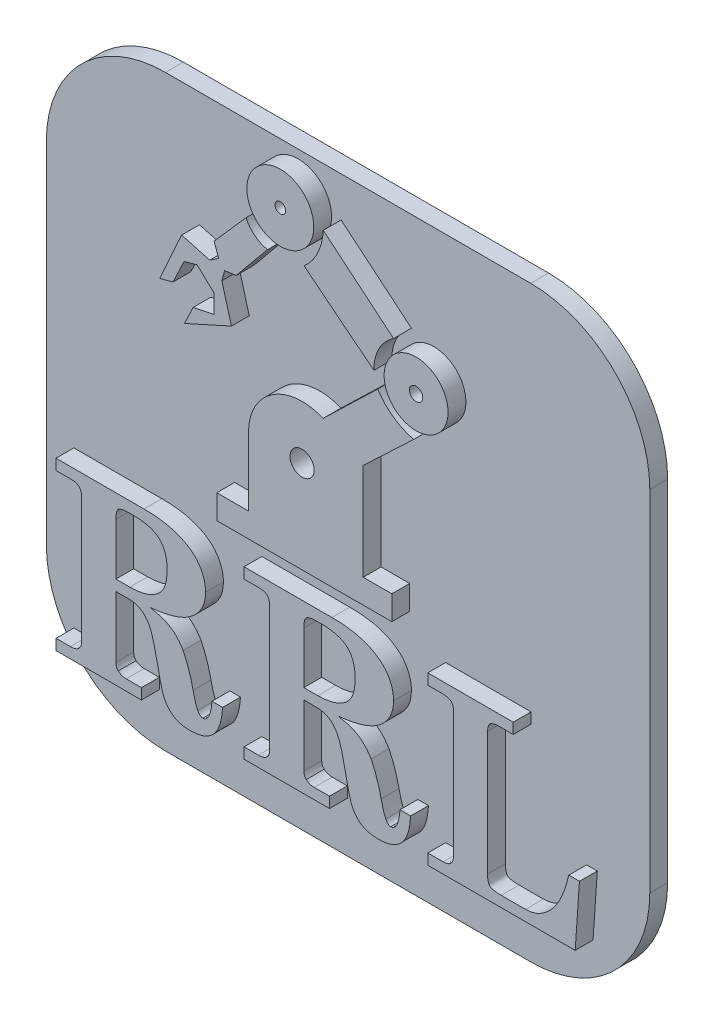
from build123d import *

# Parameters (mm, degrees)
SKETCH1_R             = 1.016959075
BOSS_EXTRUDE1_DEPTH   = 1.5
BOSS_EXTRUDE1_2_DEPTH = 1.5
BOSS_EXTRUDE1_3_DEPTH = 1.5
SKETCH1_R_2           = 2.685408693
SKETCH1_R_3           = 0.561589098
BOSS_EXTRUDE1_4_DEPTH = 1.5
SKETCH1_R_4           = 2.807006912
SKETCH1_R_5           = 0.450271141
BOSS_EXTRUDE1_5_DEPTH = 1.5
BOSS_EXTRUDE2_DEPTH   = 1.5
BOSS_EXTRUDE2_2_DEPTH = 1.5
BOSS_EXTRUDE2_3_DEPTH = 1.5
BOSS_EXTRUDE4_DEPTH   = 1.5


with BuildPart() as part:
    # Sketch1 → Boss-Extrude1 (new body)
    with BuildSketch(Plane.XY):
        with BuildLine():
            Line((15.817518323, 22.448037767), (15.817518323, 20.418411873))
            Line((15.817518323, 20.418411873), (30.520730332, 20.418411873))
            Line((30.520730332, 20.418411873), (30.520730332, 22.448037767))
            Line((30.520730332, 22.448037767), (28.118803331, 22.448037767))
            Line((28.118803331, 22.448037767), (28.118803331, 30.586880413))
            Line((28.118803331, 30.586880413), (32.356715468, 34.59428744))
            ThreePointArc((32.356715468, 34.59428744), (30.63896661, 35.379763507), (29.338154461, 36.74926033))
            Line((29.338154461, 36.74926033), (24.745314888, 32.318215988))
            ThreePointArc((24.745314888, 32.318215988), (20.540196696, 31.958270733), (18.483900556, 28.272592265))
            Line((18.483900556, 28.272592265), (18.483900556, 22.448037767))
            Line((18.483900556, 22.448037767), (15.817518323, 22.448037767))
        make_face()
        with Locations((22.98159331, 28.179719688)):
            Circle(SKETCH1_R, mode=Mode.SUBTRACT)
    extrude(amount=BOSS_EXTRUDE1_DEPTH)



with BuildPart() as body_2:
    # Sketch1 → Boss-Extrude1 2 (new body)
    with BuildSketch(Plane.XY):
        with BuildLine():
            ThreePointArc((29.015655488, 37.94504893), (29.434631401, 39.731831286), (30.665977695, 41.092683339))
            Line((30.665977695, 41.092683339), (24.760616604, 46.013803391))
            ThreePointArc((24.760616604, 46.013803391), (24.30211407, 44.150054799), (23.149625269, 42.615273725))
            Line((23.149625269, 42.615273725), (29.015655488, 37.94504893))
        make_face()
    extrude(amount=BOSS_EXTRUDE1_2_DEPTH)


with BuildPart() as body_3:
    # Sketch1 → Boss-Extrude1 3 (new body)
    with BuildSketch(Plane.XY):
        with BuildLine():
            Line((17.449253701, 39.072412667), (20.074038001, 42.260506839))
            ThreePointArc((20.074038001, 42.260506839), (19.002575479, 42.756115786), (18.276240535, 43.686759495))
            Line((18.276240535, 43.686759495), (15.591529653, 40.642489121))
            Line((15.591529653, 40.642489121), (15.976540764, 39.573653066))
            Line((15.976540764, 39.573653066), (15.224752356, 39.072412667))
            Line((15.224752356, 39.072412667), (12.860949168, 39.713785325))
            Line((12.860949168, 39.713785325), (11.025557634, 35.640511645))
            Line((11.025557634, 35.640511645), (12.148988398, 35.951717417))
            Line((12.148988398, 35.951717417), (13.064422422, 37.897977453))
            Line((13.064422422, 37.897977453), (14.160422863, 38.201584647))
            Line((14.160422863, 38.201584647), (15.591529653, 36.868222472))
            Line((15.591529653, 36.868222472), (15.591529653, 35.304552284))
            Line((15.591529653, 35.304552284), (13.826060104, 34.93121306))
            Line((13.826060104, 34.93121306), (13.110313527, 33.409498853))
            Line((13.110313527, 33.409498853), (17.044646261, 35.185280439))
            Line((17.044646261, 35.185280439), (16.243147445, 38.079509591))
            Line((16.243147445, 38.079509591), (16.476430298, 38.939282368))
            Line((16.476430298, 38.939282368), (17.449253701, 39.072412667))
        make_face()
    extrude(amount=BOSS_EXTRUDE1_3_DEPTH)


with BuildPart() as body_4:
    # Sketch1 → Boss-Extrude1 4 (new body)
    with BuildSketch(Plane.XY):
        with Locations((32.558105055, 38.010940607)):
            Circle(SKETCH1_R_2)
        with Locations((32.558105055, 38.010940607)):
            Circle(SKETCH1_R_3, mode=Mode.SUBTRACT)
    extrude(amount=BOSS_EXTRUDE1_4_DEPTH)


with BuildPart() as body_5:
    # Sketch1 → Boss-Extrude1 5 (new body)
    with BuildSketch(Plane.XY):
        with Locations((21.155122038, 45.850167403)):
            Circle(SKETCH1_R_4)
        with Locations((21.155122038, 45.850167403)):
            Circle(SKETCH1_R_5, mode=Mode.SUBTRACT)
    extrude(amount=BOSS_EXTRUDE1_5_DEPTH)


with BuildPart() as body_6:
    # Sketch2 → Boss-Extrude2 (new body)
    with BuildSketch(Plane.XY):
        with BuildLine():
            Line((2.308836419, 18.20675943), (9.69585565, 18.20675943))
            add(Edge.make_bspline(
                [(9.69585565, 18.20675943), (9.842636549, 18.204682502), (10.128847257, 18.200632664), (10.548133108, 18.182533074), (10.94659102, 18.145332644), (11.324752005, 18.095786159), (11.681333758, 18.031284482), (12.017159879, 17.953977552), (12.330785454, 17.857062954), (12.626781033, 17.752121093), (12.900887854, 17.630268745), (13.158123223, 17.501487815), (13.397155113, 17.361096027), (13.618092571, 17.210007203), (13.821853124, 17.050261025), (14.00491632, 16.8777471), (14.171221258, 16.695118132), (14.366856815, 16.439663243), (14.5703299, 16.101624942), (14.747290407, 15.668881299), (14.854641212, 15.213060341), (14.866800472, 14.900839913), (14.872938983, 14.743217763)],
                knots=[0, 0, 0, 0, 1.260796864, 2.458450407, 3.603348749, 4.696868034, 5.733149247, 6.714703153, 7.654483761, 8.551049231, 9.410311666, 10.229003047, 11.020794849, 11.789116025, 12.526438116, 13.242153704, 13.946977727, 14.645554491, 16.003253973, 17.321296627, 18.647676625, 20, 20, 20, 20], degree=3))
            add(Edge.make_bspline(
                [(14.872938983, 14.743217763), (14.868551909, 14.617667346), (14.859914649, 14.370484021), (14.793718868, 14.008399689), (14.685443408, 13.66430055), (14.527595091, 13.341300966), (14.329815152, 13.035421221), (14.086436668, 12.74847169), (13.799061115, 12.480364414), (13.581926529, 12.324343985), (13.470695393, 12.244419686)],
                knots=[0, 0, 0, 0, 1.006615866, 1.981822625, 2.942272039, 3.891414032, 4.85650664, 5.856958922, 6.902188287, 8, 8, 8, 8], degree=3))
            add(Edge.make_bspline(
                [(13.470695393, 12.244419686), (13.377304484, 12.184686972), (13.182768844, 12.060262209), (12.859920038, 11.902889802), (12.500805089, 11.763303077), (12.107237722, 11.637670389), (11.678559987, 11.525905601), (11.213283148, 11.430879565), (10.71254915, 11.352629417), (10.365379081, 11.315578457), (10.186640906, 11.296503019)],
                knots=[0, 0, 0, 0, 0.770522959, 1.605018928, 2.492419048, 3.448517842, 4.476706657, 5.572020456, 6.749971061, 8, 8, 8, 8], degree=3))
            add(Edge.make_bspline(
                [(10.186640906, 11.296503019), (10.363882657, 11.264622678), (10.69965425, 11.204227693), (11.167368754, 11.077205412), (11.569913564, 10.920203556), (11.917788716, 10.735510771), (12.221078797, 10.507523862), (12.499704238, 10.239203414), (12.759553779, 9.922261839), (12.910374779, 9.685628931), (12.988323598, 9.563329943)],
                knots=[0, 0, 0, 0, 1.260855103, 2.388598191, 3.387941535, 4.281421676, 5.137767289, 6.036055688, 6.984974634, 8, 8, 8, 8], degree=3))
            add(Edge.make_bspline(
                [(12.988323598, 9.563329943), (13.073342443, 9.383138423), (13.248654333, 9.011577079), (13.465655378, 8.413397265), (13.66774967, 7.76752895), (13.774558568, 7.314903941), (13.829669752, 7.081358789)],
                knots=[0, 0, 0, 0, 0.909803941, 1.87604819, 2.904084753, 4, 4, 4, 4], degree=3))
            add(Edge.make_bspline(
                [(13.829669752, 7.081358789), (13.86238334, 6.939034232), (13.922685743, 6.676681081), (14.018288072, 6.321009191), (14.114432513, 6.037573465), (14.187589256, 5.877800027), (14.21949347, 5.808121609)],
                knots=[0, 0, 0, 0, 1.313125144, 2.420541671, 3.311186147, 4, 4, 4, 4], degree=3))
            add(Edge.make_bspline(
                [(14.21949347, 5.808121609), (14.24903681, 5.755956284), (14.303135186, 5.660433593), (14.40890838, 5.551986737), (14.519764302, 5.47725996), (14.60086211, 5.467769354), (14.640166547, 5.463169686)],
                knots=[0, 0, 0, 0, 1.257126063, 2.301990172, 3.177051494, 4, 4, 4, 4], degree=3))
            add(Edge.make_bspline(
                [(14.640166547, 5.463169686), (14.692680283, 5.467705457), (14.797086973, 5.476723381), (14.939804195, 5.562620998), (15.061329944, 5.6947992), (15.167946514, 5.875271814), (15.251378348, 6.107047611), (15.323742678, 6.385774452), (15.378622328, 6.715241488), (15.399997617, 6.952164742), (15.411400521, 7.078554302)],
                knots=[0, 0, 0, 0, 0.646043871, 1.28445065, 2.005958554, 2.858823567, 3.864198261, 5.050731084, 6.426677019, 8, 8, 8, 8], degree=3))
            Line((15.411400521, 7.078554302), (16.308836419, 7.078554302))
            add(Edge.make_bspline(
                [(16.308836419, 7.078554302), (16.299042215, 6.946603354), (16.280164582, 6.692277251), (16.229804543, 6.325916809), (16.161347484, 5.98894241), (16.069980626, 5.68117948), (15.966241219, 5.399774327), (15.838319086, 5.148893939), (15.696802528, 4.924400356), (15.531160722, 4.732401371), (15.350051893, 4.56406753), (15.148753575, 4.421823069), (14.933214703, 4.296352985), (14.696568333, 4.199322935), (14.444733887, 4.119209), (14.173369127, 4.068639384), (13.885776912, 4.032869413), (13.687697851, 4.029175012), (13.585679368, 4.02727225)],
                knots=[0, 0, 0, 0, 1.367110356, 2.635008363, 3.819206984, 4.916686227, 5.950176123, 6.913653537, 7.822085834, 8.685534134, 9.526475961, 10.371017135, 11.227791915, 12.098023441, 13.008610734, 13.954046558, 14.946253751, 16, 16, 16, 16], degree=3))
            add(Edge.make_bspline(
                [(13.585679368, 4.02727225), (13.443240381, 4.03079077), (13.172319989, 4.03748303), (12.786940326, 4.109129397), (12.444876517, 4.224400641), (12.145769225, 4.391378097), (11.886036252, 4.602452238), (11.663976017, 4.859580538), (11.469786085, 5.155907805), (11.374342431, 5.377345339), (11.325262701, 5.491214558)],
                knots=[0, 0, 0, 0, 1.180805118, 2.245903272, 3.239527271, 4.163314747, 5.073219269, 6.002236293, 6.972695423, 8, 8, 8, 8], degree=3))
            add(Edge.make_bspline(
                [(11.325262701, 5.491214558), (11.309810233, 5.531241831), (11.274969093, 5.621492516), (11.229055641, 5.777712601), (11.175283525, 5.967118458), (11.120566638, 6.192127344), (11.058339311, 6.450944065), (10.991160128, 6.744325825), (10.920873255, 7.073384506), (10.875273435, 7.304714516), (10.851304368, 7.426310712)],
                knots=[0, 0, 0, 0, 0.51621077, 1.16391579, 1.958305469, 2.886107817, 3.950407662, 5.162257264, 6.508370262, 8, 8, 8, 8], degree=3))
            add(Edge.make_bspline(
                [(10.851304368, 7.426310712), (10.822607763, 7.568462205), (10.767606122, 7.840918317), (10.68397552, 8.232041477), (10.600215458, 8.586284783), (10.518880625, 8.904184882), (10.440895395, 9.184891215), (10.36524527, 9.428999226), (10.294089063, 9.637805742), (10.198283062, 9.861556007), (10.07151947, 10.101229487), (9.902364231, 10.354243656), (9.706135871, 10.563716842), (9.490413849, 10.737178077), (9.246746645, 10.865791775), (8.980688043, 10.96433793), (8.685330252, 11.015083981), (8.480739576, 11.023117815), (8.374942188, 11.02727225)],
                knots=[0, 0, 0, 0, 1.442191922, 2.764191877, 3.977370359, 5.061944357, 6.027372746, 6.874242926, 7.603428871, 8.219893778, 9.292850582, 10.295949872, 11.236574786, 12.136774613, 13.035292675, 13.964593533, 14.947456001, 16, 16, 16, 16], degree=3))
            Line((8.374942188, 11.02727225), (7.334477444, 11.02727225))
            Line((7.334477444, 11.02727225), (7.334477444, 5.861406866))
            add(Edge.make_bspline(
                [(7.334477444, 5.861406866), (7.33740025, 5.807920473), (7.342962029, 5.70614174), (7.378560153, 5.561942779), (7.443937345, 5.437950826), (7.505848883, 5.372212368), (7.536400521, 5.33977225)],
                knots=[0, 0, 0, 0, 1.11562849, 2.122918543, 3.073711999, 4, 4, 4, 4], degree=3))
            add(Edge.make_bspline(
                [(7.536400521, 5.33977225), (7.584647984, 5.303023158), (7.680339408, 5.230136984), (7.846802651, 5.159075433), (8.022585005, 5.110943029), (8.144636137, 5.106469273), (8.206672957, 5.104195327)],
                knots=[0, 0, 0, 0, 1.000506897, 1.984351599, 2.975475153, 4, 4, 4, 4], degree=3))
            Line((8.206672957, 5.104195327), (9.488323598, 5.104195327))
            Line((9.488323598, 5.104195327), (9.488323598, 4.20675943))
            Line((9.488323598, 4.20675943), (2.308836419, 4.20675943))
            Line((2.308836419, 4.20675943), (2.308836419, 5.104195327))
            Line((2.308836419, 5.104195327), (3.514765906, 5.104195327))
            add(Edge.make_bspline(
                [(3.514765906, 5.104195327), (3.587921751, 5.106576709), (3.72716826, 5.111109487), (3.92062123, 5.152806456), (4.088456257, 5.220064718), (4.223709566, 5.320469724), (4.334774396, 5.443099605), (4.409863688, 5.592430313), (4.456525097, 5.762323763), (4.460566509, 5.882577318), (4.462682573, 5.945541481)],
                knots=[0, 0, 0, 0, 1.215748592, 2.314083659, 3.276082243, 4.200108988, 5.092704252, 6.004076111, 6.954944175, 8, 8, 8, 8], degree=3))
            Line((4.462682573, 5.945541481), (4.462682573, 16.467977378))
            add(Edge.make_bspline(
                [(4.462682573, 16.467977378), (4.460010941, 16.535454307), (4.454986482, 16.662356184), (4.417545931, 16.840642003), (4.347026623, 16.989619822), (4.247896672, 17.109290868), (4.123572966, 17.200909337), (3.975183188, 17.265718311), (3.8033535, 17.300798085), (3.682254817, 17.306384124), (3.618531932, 17.309323532)],
                knots=[0, 0, 0, 0, 1.186255313, 2.230955505, 3.179282011, 4.054730626, 4.935716216, 5.870269018, 6.87932221, 8, 8, 8, 8], degree=3))
            Line((3.618531932, 17.309323532), (2.308836419, 17.309323532))
            Line((2.308836419, 17.309323532), (2.308836419, 18.20675943))
        make_face()
        with BuildLine():
            Line((7.334477444, 11.924708148), (8.506753085, 11.924708148))
            add(Edge.make_bspline(
                [(8.506753085, 11.924708148), (8.633083368, 11.926201443), (8.879854944, 11.929118423), (9.239507441, 11.971090897), (9.579460942, 12.030565312), (9.898778737, 12.117773265), (10.196671539, 12.230911916), (10.476799127, 12.364061768), (10.733440661, 12.528004954), (10.888934342, 12.655134452), (10.966288342, 12.718378019)],
                knots=[0, 0, 0, 0, 1.146952266, 2.240438413, 3.284842864, 4.279918954, 5.24205365, 6.176390374, 7.092802377, 8, 8, 8, 8], degree=3))
            add(Edge.make_bspline(
                [(10.966288342, 12.718378019), (11.020286355, 12.772097204), (11.129922222, 12.881166947), (11.266584303, 13.075344503), (11.385283242, 13.292212376), (11.480939432, 13.536321837), (11.551921286, 13.806743606), (11.605542395, 14.10200237), (11.635556856, 14.423824263), (11.639907498, 14.646869652), (11.642169752, 14.762849173)],
                knots=[0, 0, 0, 0, 0.823637118, 1.672286907, 2.560369197, 3.496721298, 4.503762865, 5.584178681, 6.743817119, 8, 8, 8, 8], degree=3))
            add(Edge.make_bspline(
                [(11.642169752, 14.762849173), (11.639968703, 14.869500892), (11.63571134, 15.075791216), (11.604469124, 15.373917905), (11.554961643, 15.651052911), (11.483360756, 15.906358694), (11.387189736, 16.138380548), (11.270975727, 16.347787132), (11.137559805, 16.537885863), (10.976680989, 16.702996244), (10.792178939, 16.847850651), (10.577637209, 16.972296577), (10.333598741, 17.077325316), (10.058796307, 17.165633613), (9.752686443, 17.22682683), (9.41749733, 17.274178388), (9.052380659, 17.30653947), (8.798493442, 17.308371739), (8.666608855, 17.309323532)],
                knots=[0, 0, 0, 0, 1.12607714, 2.178106663, 3.161725867, 4.096006619, 4.972319557, 5.807464053, 6.621093994, 7.416983527, 8.232587358, 9.090979501, 10.028176308, 11.033452721, 12.133172423, 13.319842628, 14.607761926, 16, 16, 16, 16], degree=3))
            add(Edge.make_bspline(
                [(8.666608855, 17.309323532), (8.596500242, 17.308731814), (8.463704089, 17.307611011), (8.273561225, 17.300720356), (8.104641782, 17.282007297), (7.954881244, 17.265833898), (7.827553492, 17.234932138), (7.717769508, 17.207830047), (7.62948437, 17.167638825), (7.534120744, 17.107110746), (7.447459827, 16.985043364), (7.379424873, 16.795004687), (7.340618887, 16.547977292), (7.336657916, 16.36434009), (7.334477444, 16.263249814)],
                knots=[0, 0, 0, 0, 1.234073475, 2.337518953, 3.345986092, 4.225559855, 4.983998792, 5.650694609, 6.210333431, 6.684906202, 7.622862998, 8.768671454, 10.221188891, 12, 12, 12, 12], degree=3))
            Line((7.334477444, 16.263249814), (7.334477444, 11.924708148))
        make_face(mode=Mode.SUBTRACT)
    extrude(amount=BOSS_EXTRUDE2_DEPTH)


with BuildPart() as body_7:
    # Sketch2 → Boss-Extrude2 2 (new body)
    with BuildSketch(Plane.XY):
        with BuildLine():
            Line((18.103708214, 18.20675943), (25.490727444, 18.20675943))
            add(Edge.make_bspline(
                [(25.490727444, 18.20675943), (25.637508344, 18.204682502), (25.923719051, 18.200632664), (26.343004903, 18.182533074), (26.741462815, 18.145332644), (27.1196238, 18.095786159), (27.476205553, 18.031284482), (27.812031674, 17.953977552), (28.125657249, 17.857062954), (28.421652828, 17.752121093), (28.695759649, 17.630268745), (28.952995018, 17.501487815), (29.192026908, 17.361096027), (29.412964365, 17.210007203), (29.616724919, 17.050261025), (29.799788115, 16.8777471), (29.966093052, 16.695118132), (30.161728609, 16.439663243), (30.365201695, 16.101624942), (30.542162202, 15.668881299), (30.649513007, 15.213060341), (30.661672266, 14.900839913), (30.667810778, 14.743217763)],
                knots=[0, 0, 0, 0, 1.260796864, 2.458450407, 3.603348749, 4.696868034, 5.733149247, 6.714703153, 7.654483761, 8.551049231, 9.410311666, 10.229003047, 11.020794849, 11.789116025, 12.526438116, 13.242153704, 13.946977727, 14.645554491, 16.003253973, 17.321296627, 18.647676625, 20, 20, 20, 20], degree=3))
            add(Edge.make_bspline(
                [(30.667810778, 14.743217763), (30.663423704, 14.617667346), (30.654786444, 14.370484021), (30.588590663, 14.008399689), (30.480315203, 13.66430055), (30.322466885, 13.341300966), (30.124686946, 13.035421221), (29.881308463, 12.74847169), (29.59393291, 12.480364414), (29.376798323, 12.324343985), (29.265567188, 12.244419686)],
                knots=[0, 0, 0, 0, 1.006615866, 1.981822625, 2.942272039, 3.891414032, 4.85650664, 5.856958922, 6.902188287, 8, 8, 8, 8], degree=3))
            add(Edge.make_bspline(
                [(29.265567188, 12.244419686), (29.172176279, 12.184686972), (28.977640639, 12.060262209), (28.654791833, 11.902889802), (28.295676884, 11.763303077), (27.902109517, 11.637670389), (27.473431782, 11.525905601), (27.008154943, 11.430879565), (26.507420945, 11.352629417), (26.160250876, 11.315578457), (25.981512701, 11.296503019)],
                knots=[0, 0, 0, 0, 0.770522959, 1.605018928, 2.492419048, 3.448517842, 4.476706657, 5.572020456, 6.749971061, 8, 8, 8, 8], degree=3))
            add(Edge.make_bspline(
                [(25.981512701, 11.296503019), (26.158754452, 11.264622678), (26.494526045, 11.204227693), (26.962240549, 11.077205412), (27.364785359, 10.920203556), (27.712660511, 10.735510771), (28.015950591, 10.507523862), (28.294576033, 10.239203414), (28.554425574, 9.922261839), (28.705246574, 9.685628931), (28.783195393, 9.563329943)],
                knots=[0, 0, 0, 0, 1.260855103, 2.388598191, 3.387941535, 4.281421676, 5.137767289, 6.036055688, 6.984974634, 8, 8, 8, 8], degree=3))
            add(Edge.make_bspline(
                [(28.783195393, 9.563329943), (28.868214238, 9.383138423), (29.043526128, 9.011577079), (29.260527173, 8.413397265), (29.462621465, 7.76752895), (29.569430363, 7.314903941), (29.624541547, 7.081358789)],
                knots=[0, 0, 0, 0, 0.909803941, 1.87604819, 2.904084753, 4, 4, 4, 4], degree=3))
            add(Edge.make_bspline(
                [(29.624541547, 7.081358789), (29.657255135, 6.939034232), (29.717557538, 6.676681081), (29.813159867, 6.321009191), (29.909304308, 6.037573465), (29.98246105, 5.877800027), (30.014365265, 5.808121609)],
                knots=[0, 0, 0, 0, 1.313125144, 2.420541671, 3.311186147, 4, 4, 4, 4], degree=3))
            add(Edge.make_bspline(
                [(30.014365265, 5.808121609), (30.043908605, 5.755956284), (30.098006981, 5.660433593), (30.203780175, 5.551986737), (30.314636097, 5.47725996), (30.395733905, 5.467769354), (30.435038342, 5.463169686)],
                knots=[0, 0, 0, 0, 1.257126063, 2.301990172, 3.177051494, 4, 4, 4, 4], degree=3))
            add(Edge.make_bspline(
                [(30.435038342, 5.463169686), (30.487552078, 5.467705457), (30.591958768, 5.476723381), (30.73467599, 5.562620998), (30.856201739, 5.6947992), (30.962818309, 5.875271814), (31.046250143, 6.107047611), (31.118614473, 6.385774452), (31.173494123, 6.715241488), (31.194869412, 6.952164742), (31.206272316, 7.078554302)],
                knots=[0, 0, 0, 0, 0.646043871, 1.28445065, 2.005958554, 2.858823567, 3.864198261, 5.050731084, 6.426677019, 8, 8, 8, 8], degree=3))
            Line((31.206272316, 7.078554302), (32.103708214, 7.078554302))
            add(Edge.make_bspline(
                [(32.103708214, 7.078554302), (32.09391401, 6.946603354), (32.075036377, 6.692277251), (32.024676338, 6.325916809), (31.956219279, 5.98894241), (31.864852421, 5.68117948), (31.761113014, 5.399774327), (31.633190881, 5.148893939), (31.491674323, 4.924400356), (31.326032517, 4.732401371), (31.144923688, 4.56406753), (30.94362537, 4.421823069), (30.728086498, 4.296352985), (30.491440128, 4.199322935), (30.239605682, 4.119209), (29.968240922, 4.068639384), (29.680648707, 4.032869413), (29.482569646, 4.029175012), (29.380551162, 4.02727225)],
                knots=[0, 0, 0, 0, 1.367110356, 2.635008363, 3.819206984, 4.916686227, 5.950176123, 6.913653537, 7.822085834, 8.685534134, 9.526475961, 10.371017135, 11.227791915, 12.098023441, 13.008610734, 13.954046558, 14.946253751, 16, 16, 16, 16], degree=3))
            add(Edge.make_bspline(
                [(29.380551162, 4.02727225), (29.238112176, 4.03079077), (28.967191784, 4.03748303), (28.58181212, 4.109129397), (28.239748312, 4.224400641), (27.94064102, 4.391378097), (27.680908047, 4.602452238), (27.458847812, 4.859580538), (27.26465788, 5.155907805), (27.169214225, 5.377345339), (27.120134496, 5.491214558)],
                knots=[0, 0, 0, 0, 1.180805118, 2.245903272, 3.239527271, 4.163314747, 5.073219269, 6.002236293, 6.972695423, 8, 8, 8, 8], degree=3))
            add(Edge.make_bspline(
                [(27.120134496, 5.491214558), (27.104682028, 5.531241831), (27.069840888, 5.621492516), (27.023927436, 5.777712601), (26.97015532, 5.967118458), (26.915438433, 6.192127344), (26.853211106, 6.450944065), (26.786031923, 6.744325825), (26.71574505, 7.073384506), (26.67014523, 7.304714516), (26.646176162, 7.426310712)],
                knots=[0, 0, 0, 0, 0.51621077, 1.16391579, 1.958305469, 2.886107817, 3.950407662, 5.162257264, 6.508370262, 8, 8, 8, 8], degree=3))
            add(Edge.make_bspline(
                [(26.646176162, 7.426310712), (26.617479558, 7.568462205), (26.562477917, 7.840918317), (26.478847315, 8.232041477), (26.395087253, 8.586284783), (26.31375242, 8.904184882), (26.23576719, 9.184891215), (26.160117065, 9.428999226), (26.088960858, 9.637805742), (25.993154857, 9.861556007), (25.866391265, 10.101229487), (25.697236026, 10.354243656), (25.501007665, 10.563716842), (25.285285644, 10.737178077), (25.04161844, 10.865791775), (24.775559838, 10.96433793), (24.480202047, 11.015083981), (24.275611371, 11.023117815), (24.169813983, 11.02727225)],
                knots=[0, 0, 0, 0, 1.442191922, 2.764191877, 3.977370359, 5.061944357, 6.027372746, 6.874242926, 7.603428871, 8.219893778, 9.292850582, 10.295949872, 11.236574786, 12.136774613, 13.035292675, 13.964593533, 14.947456001, 16, 16, 16, 16], degree=3))
            Line((24.169813983, 11.02727225), (23.129349239, 11.02727225))
            Line((23.129349239, 11.02727225), (23.129349239, 5.861406866))
            add(Edge.make_bspline(
                [(23.129349239, 5.861406866), (23.132272045, 5.807920473), (23.137833824, 5.70614174), (23.173431948, 5.561942779), (23.23880914, 5.437950826), (23.300720678, 5.372212368), (23.331272316, 5.33977225)],
                knots=[0, 0, 0, 0, 1.11562849, 2.122918543, 3.073711999, 4, 4, 4, 4], degree=3))
            add(Edge.make_bspline(
                [(23.331272316, 5.33977225), (23.379519779, 5.303023158), (23.475211203, 5.230136984), (23.641674446, 5.159075433), (23.8174568, 5.110943029), (23.939507932, 5.106469273), (24.001544752, 5.104195327)],
                knots=[0, 0, 0, 0, 1.000506897, 1.984351599, 2.975475153, 4, 4, 4, 4], degree=3))
            Line((24.001544752, 5.104195327), (25.283195393, 5.104195327))
            Line((25.283195393, 5.104195327), (25.283195393, 4.20675943))
            Line((25.283195393, 4.20675943), (18.103708214, 4.20675943))
            Line((18.103708214, 4.20675943), (18.103708214, 5.104195327))
            Line((18.103708214, 5.104195327), (19.309637701, 5.104195327))
            add(Edge.make_bspline(
                [(19.309637701, 5.104195327), (19.382793546, 5.106576709), (19.522040054, 5.111109487), (19.715493024, 5.152806456), (19.883328052, 5.220064718), (20.018581361, 5.320469724), (20.129646191, 5.443099605), (20.204735483, 5.592430313), (20.251396892, 5.762323763), (20.255438304, 5.882577318), (20.257554368, 5.945541481)],
                knots=[0, 0, 0, 0, 1.215748592, 2.314083659, 3.276082243, 4.200108988, 5.092704252, 6.004076111, 6.954944175, 8, 8, 8, 8], degree=3))
            Line((20.257554368, 5.945541481), (20.257554368, 16.467977378))
            add(Edge.make_bspline(
                [(20.257554368, 16.467977378), (20.254882736, 16.535454307), (20.249858277, 16.662356184), (20.212417725, 16.840642003), (20.141898418, 16.989619822), (20.042768467, 17.109290868), (19.918444761, 17.200909337), (19.770054983, 17.265718311), (19.598225294, 17.300798085), (19.477126612, 17.306384124), (19.413403726, 17.309323532)],
                knots=[0, 0, 0, 0, 1.186255313, 2.230955505, 3.179282011, 4.054730626, 4.935716216, 5.870269018, 6.87932221, 8, 8, 8, 8], degree=3))
            Line((19.413403726, 17.309323532), (18.103708214, 17.309323532))
            Line((18.103708214, 17.309323532), (18.103708214, 18.20675943))
        make_face()
        with BuildLine():
            Line((23.129349239, 11.924708148), (24.30162488, 11.924708148))
            add(Edge.make_bspline(
                [(24.30162488, 11.924708148), (24.427955163, 11.926201443), (24.674726739, 11.929118423), (25.034379236, 11.971090897), (25.374332736, 12.030565312), (25.693650532, 12.117773265), (25.991543334, 12.230911916), (26.271670922, 12.364061768), (26.528312456, 12.528004954), (26.683806137, 12.655134452), (26.761160137, 12.718378019)],
                knots=[0, 0, 0, 0, 1.146952266, 2.240438413, 3.284842864, 4.279918954, 5.24205365, 6.176390374, 7.092802377, 8, 8, 8, 8], degree=3))
            add(Edge.make_bspline(
                [(26.761160137, 12.718378019), (26.81515815, 12.772097204), (26.924794017, 12.881166947), (27.061456097, 13.075344503), (27.180155036, 13.292212376), (27.275811227, 13.536321837), (27.346793081, 13.806743606), (27.40041419, 14.10200237), (27.430428651, 14.423824263), (27.434779293, 14.646869652), (27.437041547, 14.762849173)],
                knots=[0, 0, 0, 0, 0.823637118, 1.672286907, 2.560369197, 3.496721298, 4.503762865, 5.584178681, 6.743817119, 8, 8, 8, 8], degree=3))
            add(Edge.make_bspline(
                [(27.437041547, 14.762849173), (27.434840498, 14.869500892), (27.430583135, 15.075791216), (27.399340919, 15.373917905), (27.349833438, 15.651052911), (27.278232551, 15.906358694), (27.18206153, 16.138380548), (27.065847522, 16.347787132), (26.9324316, 16.537885863), (26.771552784, 16.702996244), (26.587050734, 16.847850651), (26.372509004, 16.972296577), (26.128470536, 17.077325316), (25.853668102, 17.165633613), (25.547558237, 17.22682683), (25.212369125, 17.274178388), (24.847252454, 17.30653947), (24.593365237, 17.308371739), (24.46148065, 17.309323532)],
                knots=[0, 0, 0, 0, 1.12607714, 2.178106663, 3.161725867, 4.096006619, 4.972319557, 5.807464053, 6.621093994, 7.416983527, 8.232587358, 9.090979501, 10.028176308, 11.033452721, 12.133172423, 13.319842628, 14.607761926, 16, 16, 16, 16], degree=3))
            add(Edge.make_bspline(
                [(24.46148065, 17.309323532), (24.391372037, 17.308731814), (24.258575884, 17.307611011), (24.06843302, 17.300720356), (23.899513577, 17.282007297), (23.749753039, 17.265833898), (23.622425286, 17.234932138), (23.512641303, 17.207830047), (23.424356165, 17.167638825), (23.328992539, 17.107110746), (23.242331622, 16.985043364), (23.174296668, 16.795004687), (23.135490682, 16.547977292), (23.131529711, 16.36434009), (23.129349239, 16.263249814)],
                knots=[0, 0, 0, 0, 1.234073475, 2.337518953, 3.345986092, 4.225559855, 4.983998792, 5.650694609, 6.210333431, 6.684906202, 7.622862998, 8.768671454, 10.221188891, 12, 12, 12, 12], degree=3))
            Line((23.129349239, 16.263249814), (23.129349239, 11.924708148))
        make_face(mode=Mode.SUBTRACT)
    extrude(amount=BOSS_EXTRUDE2_2_DEPTH)


with BuildPart() as body_8:
    # Sketch2 → Boss-Extrude2 3 (new body)
    with BuildSketch(Plane.XY):
        with BuildLine():
            Line((33.53960565, 17.309323532), (33.53960565, 18.20675943))
            Line((33.53960565, 18.20675943), (40.719092829, 18.20675943))
            Line((40.719092829, 18.20675943), (40.719092829, 17.309323532))
            Line((40.719092829, 17.309323532), (39.50474988, 17.309323532))
            add(Edge.make_bspline(
                [(39.50474988, 17.309323532), (39.424104429, 17.308222154), (39.27475161, 17.306182436), (39.070005273, 17.265475012), (38.900705635, 17.207874577), (38.768368864, 17.117158201), (38.67600585, 16.994882824), (38.610444561, 16.846354582), (38.572593405, 16.667061667), (38.567806391, 16.537341461), (38.565246675, 16.467977378)],
                knots=[0, 0, 0, 0, 1.317174052, 2.439364582, 3.40274332, 4.226216974, 5.021934816, 5.877883306, 6.86526021, 8, 8, 8, 8], degree=3))
            Line((38.565246675, 16.467977378), (38.565246675, 6.08576584))
            add(Edge.make_bspline(
                [(38.565246675, 6.08576584), (38.566265613, 5.990225478), (38.568114911, 5.816826611), (38.607049339, 5.58436863), (38.664146576, 5.404511283), (38.757725071, 5.266287503), (38.915444852, 5.188638406), (39.122480882, 5.14154883), (39.395373811, 5.108306373), (39.599065129, 5.105664016), (39.712281932, 5.104195327)],
                knots=[0, 0, 0, 0, 1.253318516, 2.274682744, 3.08242206, 3.723352428, 4.399534733, 5.325689848, 6.513550565, 8, 8, 8, 8], degree=3))
            Line((39.712281932, 5.104195327), (41.751144111, 5.104195327))
            add(Edge.make_bspline(
                [(41.751144111, 5.104195327), (41.845778793, 5.107558783), (42.034366239, 5.114261457), (42.313505928, 5.164468449), (42.588718942, 5.241315459), (42.854951373, 5.36064889), (43.12084816, 5.502312068), (43.37860086, 5.681266371), (43.632482705, 5.890698393), (43.881757458, 6.131064811), (44.121971761, 6.407469014), (44.346035726, 6.723704606), (44.556252913, 7.078575281), (44.75153563, 7.47191783), (44.933176262, 7.902088084), (45.102758185, 8.369539025), (45.251912026, 8.877229971), (45.340276716, 9.23020533), (45.385759496, 9.411887635)],
                knots=[0, 0, 0, 0, 0.746952398, 1.488522408, 2.233867827, 2.997739128, 3.787258218, 4.610437708, 5.470623944, 6.384302497, 7.342016262, 8.35813022, 9.440650158, 10.596202486, 11.823439516, 13.126538548, 14.520981459, 16, 16, 16, 16], degree=3))
            Line((45.385759496, 9.411887635), (46.283195393, 9.411887635))
            Line((46.283195393, 9.411887635), (45.924221034, 4.20675943))
            Line((45.924221034, 4.20675943), (33.53960565, 4.20675943))
            Line((33.53960565, 4.20675943), (33.53960565, 5.104195327))
            Line((33.53960565, 5.104195327), (34.829669752, 5.104195327))
            add(Edge.make_bspline(
                [(34.829669752, 5.104195327), (34.896214719, 5.106915832), (35.023097576, 5.112103084), (35.200476953, 5.149698943), (35.351763866, 5.21621425), (35.478791934, 5.305876887), (35.574443789, 5.424813429), (35.647790826, 5.561985948), (35.685503394, 5.723932342), (35.690710206, 5.837871583), (35.693451803, 5.897865199)],
                knots=[0, 0, 0, 0, 1.195528741, 2.279542841, 3.234602015, 4.14844858, 5.043106676, 5.952155301, 6.921726988, 8, 8, 8, 8], degree=3))
            Line((35.693451803, 5.897865199), (35.693451803, 16.571743404))
            add(Edge.make_bspline(
                [(35.693451803, 16.571743404), (35.691093083, 16.631837811), (35.686639687, 16.745299418), (35.645016135, 16.902907964), (35.573279091, 17.034622607), (35.469840075, 17.14044532), (35.33203828, 17.22122246), (35.154965454, 17.270918689), (34.941267316, 17.304510436), (34.784965611, 17.307637131), (34.700663342, 17.309323532)],
                knots=[0, 0, 0, 0, 1.00990991, 1.906766507, 2.716615905, 3.506507968, 4.367174043, 5.37229384, 6.582730811, 8, 8, 8, 8], degree=3))
            Line((34.700663342, 17.309323532), (33.53960565, 17.309323532))
        make_face()
    extrude(amount=BOSS_EXTRUDE2_3_DEPTH)


with BuildPart() as part_1:
    add(part.part)

    add(body_2.part)  # Boss-Extrude4 merges body 2

    add(body_3.part)  # Boss-Extrude4 merges body 3

    add(body_4.part)  # Boss-Extrude4 merges body 4

    add(body_5.part)  # Boss-Extrude4 merges body 5

    add(body_6.part)  # Boss-Extrude4 merges body 6

    add(body_7.part)  # Boss-Extrude4 merges body 7

    add(body_8.part)  # Boss-Extrude4 merges body 8
    # Sketch4 → Boss-Extrude4 (add)
    with BuildSketch(Plane.XY):
        with BuildLine():
            Line((10, 0), (40.691596326, 0))
            ThreePointArc((40.691596326, 0), (47.762664137, 2.928932188), (50.691596326, 10))
            Line((50.691596326, 10), (50.691596326, 39.370710297))
            ThreePointArc((50.691596326, 39.370710297), (47.762664137, 46.441778109), (40.691596326, 49.370710297))
            Line((40.691596326, 49.370710297), (10, 49.370710297))
            ThreePointArc((10, 49.370710297), (2.928932188, 46.441778109), (0, 39.370710297))
            Line((0, 39.370710297), (0, 10))
            ThreePointArc((0, 10), (2.928932188, 2.928932188), (10, 0))
        make_face()
    extrude(amount=-BOSS_EXTRUDE4_DEPTH)


solid = part_1.part
